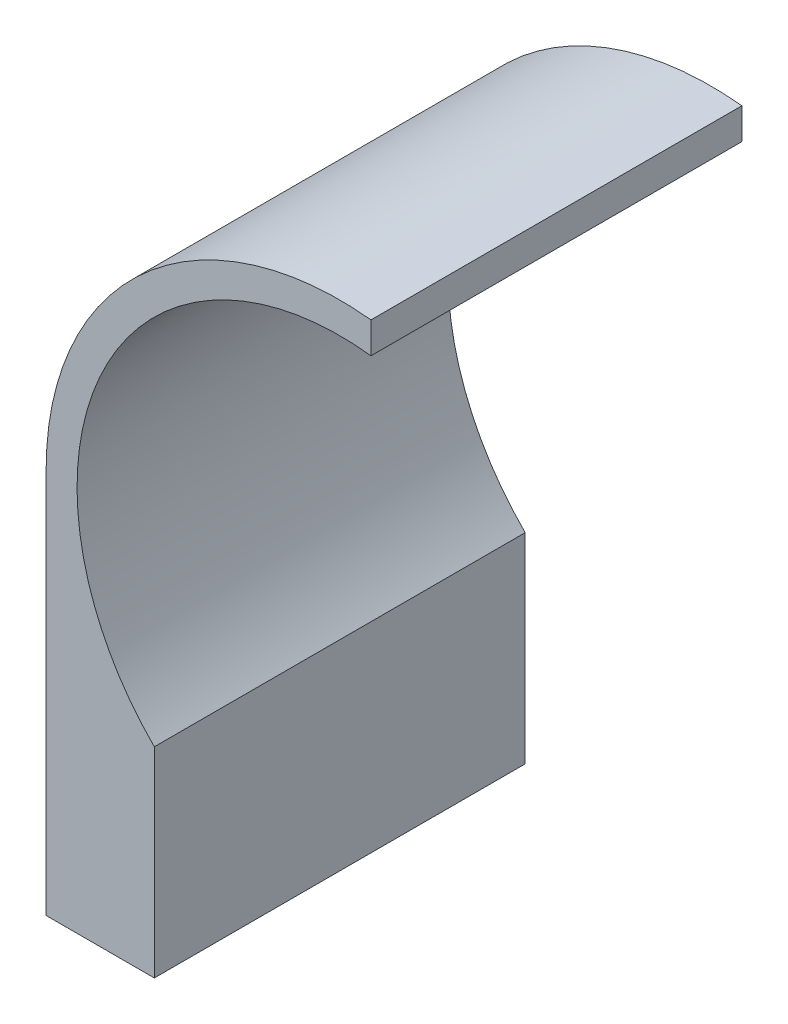
from build123d import *

# Parameters (mm, degrees)
INNER_RING_LEFT_SIDE_DEPTH = 120


with BuildPart() as part:
    # Sketch1 → Inner Ring - Left Side (new body)
    with BuildSketch(Plane.XY):
        with BuildLine():
            Line((-60, -60.207972894), (-60, -125))
            Line((-60, -125), (-95, -125))
            Line((-95, -125), (-95, 0))
            ThreePointArc((-95, 0), (-63.503936886, 70.655856091), (10.1, 94.461579491))
            Line((10.1, 94.461579491), (10.1, 84.397808028))
            ThreePointArc((10.1, 84.397808028), (-76.486668571, 37.078154363), (-60, -60.207972894))
        make_face()
    extrude(amount=INNER_RING_LEFT_SIDE_DEPTH)


solid = part.part
